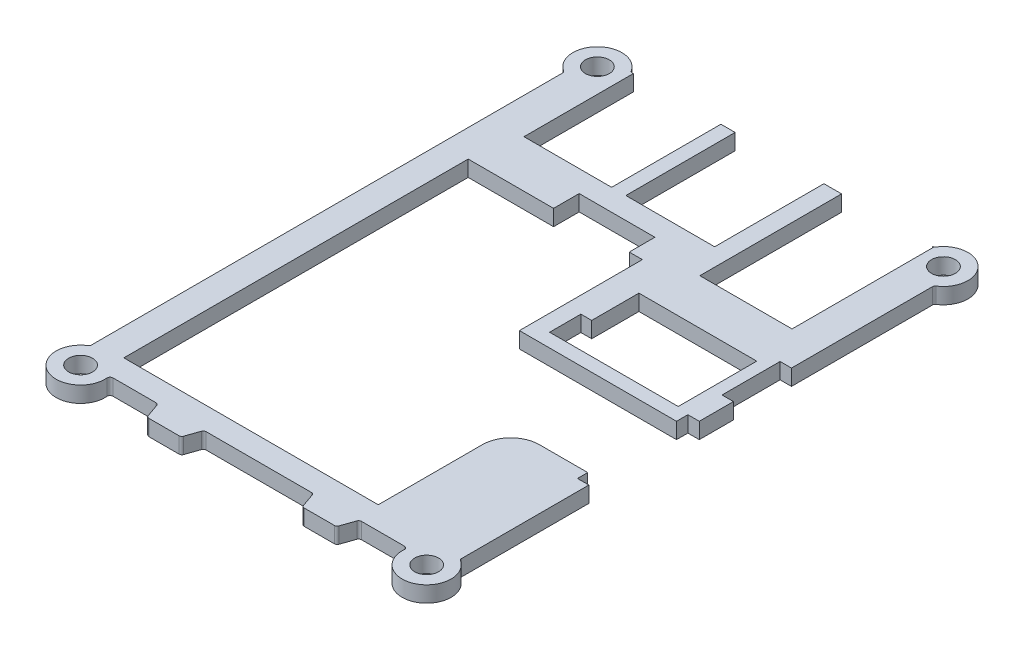
from build123d import *

# Parameters (mm, degrees)
BASEPLATE_OUTLINE_R = 2.1
BASEPLATE_DEPTH     = 2.8
CUT_EXTRUDE1_REACH  = 115.438
SKETCH3_W           = 15.4
SKETCH3_H           = 19.2
SKETCH3_W_2         = 15.6
SKETCH3_W_3         = 16.2
SKETCH3_H_2         = 24.9
CUT_EXTRUDE2_REACH  = 115.438
SKETCH4_W           = 2
SKETCH4_H           = 10.2
FILLET1_R           = 5


# Read off the part's stored shape, not the designer's step: BasePlate
with BuildPart() as part:
    # BasePlate outline → BasePlate (new body)
    with BuildSketch(Plane(origin=(0, 0, 0), x_dir=(1, 0, 0), z_dir=(0, 1, 0))):
        with BuildLine():
            Line((43.502626614, -5.852332608), (48.792614178, -5.852332608))
            ThreePointArc((48.792614178, -5.852332608), (49.082078508, -5.760021707), (49.264659986, -5.517174213))
            Line((49.264659986, -5.517174213), (50.078201202, -3.187491002))
            ThreePointArc((50.078201202, -3.187491002), (50.26078268, -2.944643509), (50.55024701, -2.852332608))
            Line((50.55024701, -2.852332608), (58.116695703, -2.852332608))
            ThreePointArc((58.116695703, -2.852332608), (58.484685739, -3.013831008), (58.614956567, -3.393999275))
            ThreePointArc((58.614956567, -3.393999275), (64.799237397, -7.61016844), (65.229166667, -0.137781095))
            ThreePointArc((65.229166667, -0.137781095), (65.061014427, 0.043158816), (65, 0.282515593))
            Line((65, 0.282515593), (65, 83.012819192))
            ThreePointArc((65, 83.012819192), (65.061014427, 83.252175969), (65.229166667, 83.433115879))
            ThreePointArc((65.229166667, 83.433115879), (65.940559159, 90.088226551), (59.285448487, 89.376834059))
            ThreePointArc((59.285448487, 89.376834059), (59.104508577, 89.208681819), (58.8651518, 89.147667392))
            Line((58.8651518, 89.147667392), (6.1348482, 89.147667392))
            ThreePointArc((6.1348482, 89.147667392), (5.895491423, 89.208681819), (5.714551513, 89.376834059))
            ThreePointArc((5.714551513, 89.376834059), (-0.940559159, 90.088226551), (-0.229166667, 83.433115879))
            ThreePointArc((-0.229166667, 83.433115879), (-0.061014427, 83.252175969), (0, 83.012819192))
            Line((0, 83.012819192), (0, 0.282515593))
            ThreePointArc((0, 0.282515593), (-0.061014427, 0.043158816), (-0.229166667, -0.137781095))
            ThreePointArc((-0.229166667, -0.137781095), (0.200762603, -7.61016844), (6.385043433, -3.393999275))
            ThreePointArc((6.385043433, -3.393999275), (6.515314261, -3.013831008), (6.883304297, -2.852332608))
            Line((6.883304297, -2.852332608), (14.44975299, -2.852332608))
            ThreePointArc((14.44975299, -2.852332608), (14.73921732, -2.944643509), (14.921798798, -3.187491002))
            Line((14.921798798, -3.187491002), (15.735340014, -5.517174213))
            ThreePointArc((15.735340014, -5.517174213), (15.917921492, -5.760021707), (16.207385822, -5.852332608))
            Line((16.207385822, -5.852332608), (21.497373386, -5.852332608))
            ThreePointArc((21.497373386, -5.852332608), (21.786837716, -5.760021707), (21.969419194, -5.517174213))
            Line((21.969419194, -5.517174213), (22.78296041, -3.187491002))
            ThreePointArc((22.78296041, -3.187491002), (22.965541888, -2.944643509), (23.255006218, -2.852332608))
            Line((23.255006218, -2.852332608), (41.744993782, -2.852332608))
            ThreePointArc((41.744993782, -2.852332608), (42.034458112, -2.944643509), (42.21703959, -3.187491002))
            Line((42.21703959, -3.187491002), (43.030580806, -5.517174213))
            ThreePointArc((43.030580806, -5.517174213), (43.213162284, -5.760021707), (43.502626614, -5.852332608))
        make_face()
        with Locations((2.1, -3.752332608)):
            Circle(BASEPLATE_OUTLINE_R, mode=Mode.SUBTRACT)
        with Locations((62.9, -3.752332608)):
            Circle(BASEPLATE_OUTLINE_R, mode=Mode.SUBTRACT)
        with Locations((2.1, 87.047667392)):
            Circle(BASEPLATE_OUTLINE_R, mode=Mode.SUBTRACT)
        with Locations((62.9, 87.047667392)):
            Circle(BASEPLATE_OUTLINE_R, mode=Mode.SUBTRACT)
    extrude(amount=BASEPLATE_DEPTH)

    # Sketch3 → Cut-Extrude1 (cut, up to next)
    with BuildSketch(Plane(origin=(0, 2.8, 0), x_dir=(1, 0, 0), z_dir=(0, 1, 0)), mode=Mode.PRIVATE) as cut_extrude1_sk1:
        Polygon((4.8, 1.147667392), (49.5, 1.147667392), (49.5, 24.447667392), (63, 24.447667392), (63, 22.647667392), (65, 22.647667392), (65, 42.047667392), (63, 42.047667392), (63, 40.047667392), (35.4, 40.047667392), (35.4, 61.647667392), (33.1, 61.647667392), (33.1, 66.147667392), (19.8, 66.147667392), (19.8, 61.647667392), (4.8, 61.647667392), align=None)
    cut_extrude1_tool1 = extrude(cut_extrude1_sk1.sketch, amount=-CUT_EXTRUDE1_REACH, mode=Mode.PRIVATE) & part.part
    # Sketch3 → Cut-Extrude1 (cut, up to next)
    with BuildSketch(Plane(origin=(0, 2.8, 0), x_dir=(1, 0, 0), z_dir=(0, 1, 0)), mode=Mode.PRIVATE) as cut_extrude1_sk2:
        with Locations((14, 79.547667392)):
            Rectangle(SKETCH3_W, SKETCH3_H)
    cut_extrude1_tool2 = extrude(cut_extrude1_sk2.sketch, amount=-CUT_EXTRUDE1_REACH, mode=Mode.PRIVATE) & part.part
    # Sketch3 → Cut-Extrude1 (cut, up to next)
    with BuildSketch(Plane(origin=(0, 2.8, 0), x_dir=(1, 0, 0), z_dir=(0, 1, 0)), mode=Mode.PRIVATE) as cut_extrude1_sk3:
        with Locations((32, 79.547667392)):
            Rectangle(SKETCH3_W_2, SKETCH3_H)
    cut_extrude1_tool3 = extrude(cut_extrude1_sk3.sketch, amount=-CUT_EXTRUDE1_REACH, mode=Mode.PRIVATE) & part.part
    # Sketch3 → Cut-Extrude1 (cut, up to next)
    with BuildSketch(Plane(origin=(0, 2.8, 0), x_dir=(1, 0, 0), z_dir=(0, 1, 0)), mode=Mode.PRIVATE) as cut_extrude1_sk4:
        with Locations((51, 76.697667392)):
            Rectangle(SKETCH3_W_3, SKETCH3_H_2)
    cut_extrude1_tool4 = extrude(cut_extrude1_sk4.sketch, amount=-CUT_EXTRUDE1_REACH, mode=Mode.PRIVATE) & part.part
    add(cut_extrude1_tool1.solids().sort_by_distance((28.204461, 2.8, -30.008726))[0], mode=Mode.SUBTRACT)
    add(cut_extrude1_tool2.solids().sort_by_distance((14, 2.8, -79.547667))[0], mode=Mode.SUBTRACT)
    add(cut_extrude1_tool3.solids().sort_by_distance((32, 2.8, -79.547667))[0], mode=Mode.SUBTRACT)
    add(cut_extrude1_tool4.solids().sort_by_distance((51, 2.8, -76.697667))[0], mode=Mode.SUBTRACT)

    # Sketch4 → Cut-Extrude2 (cut, up to next)
    with BuildSketch(Plane(origin=(0, 2.8, 0), x_dir=(1, 0, 0), z_dir=(0, 1, 0)), mode=Mode.PRIVATE) as cut_extrude2_sk1:
        with Locations((64, 53.147667392)):
            Rectangle(SKETCH4_W, SKETCH4_H)
    cut_extrude2_tool1 = extrude(cut_extrude2_sk1.sketch, amount=-CUT_EXTRUDE2_REACH, mode=Mode.PRIVATE) & part.part
    # Sketch4 → Cut-Extrude2 (cut, up to next)
    with BuildSketch(Plane(origin=(0, 2.8, 0), x_dir=(1, 0, 0), z_dir=(0, 1, 0)), mode=Mode.PRIVATE) as cut_extrude2_sk2:
        Polygon((60.9, 56.247667392), (40.2, 56.247667392), (40.2, 47.947667392), (38.3, 47.947667392), (38.3, 42.447667392), (60.9, 42.447667392), (60.9, 50.047667392), align=None)
    cut_extrude2_tool2 = extrude(cut_extrude2_sk2.sketch, amount=-CUT_EXTRUDE2_REACH, mode=Mode.PRIVATE) & part.part
    add(cut_extrude2_tool1.solids().sort_by_distance((64, 2.8, -53.147667))[0], mode=Mode.SUBTRACT)
    add(cut_extrude2_tool2.solids().sort_by_distance((50.151212, 2.8, -49.20121))[0], mode=Mode.SUBTRACT)

    # Fillet1
    fillet1_edges = [part.edges().sort_by_distance(p)[0] for p in [
        (49.5, 1.4, -24.447667392),
    ]]
    fillet(fillet1_edges, radius=FILLET1_R)


solid = part.part
